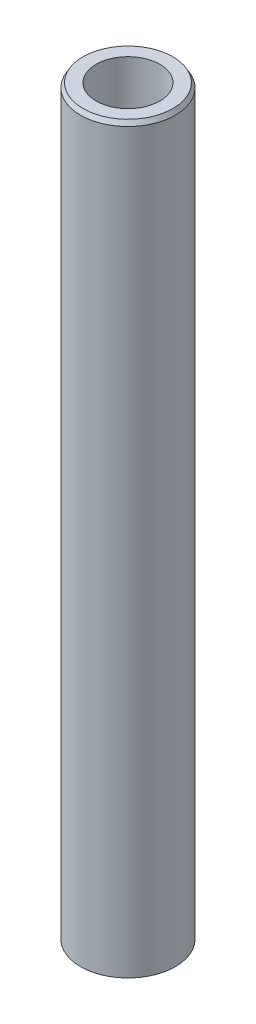
from build123d import *
from OCP.BRepFilletAPI import BRepFilletAPI_MakeChamfer

# Parameters (mm, degrees)
SKETCH1_R           = 12.5
BOSS_EXTRUDE1_DEPTH = 196.030144605
SKETCH2_R           = 8.387301792
CUT_EXTRUDE1_DEPTH  = 197.825601977
CHAMFER1_SIZE       = 1.175320227
CHAMFER1_SIZE2      = 0.678571449


with BuildPart() as part:
    # Sketch1 → Boss-Extrude1 (new body)
    with BuildSketch(Plane(origin=(0, 0, 0), x_dir=(1, 0, 0), z_dir=(0, 1, 0))):
        Circle(SKETCH1_R)
    extrude(amount=BOSS_EXTRUDE1_DEPTH)

    # Sketch2 → Cut-Extrude1 (cut, through all)
    with BuildSketch(Plane(origin=(0, 0, 0), x_dir=(1, 0, 0), z_dir=(0, 1, 0))):
        Circle(SKETCH2_R)
    extrude(amount=CUT_EXTRUDE1_DEPTH, mode=Mode.SUBTRACT)

    # Chamfer1: one chamfer whose edges measure the first distance from different faces: ONE call of the kernel's chamfer builder (chamfer() names one face for all edges)
    chamfer1_edges_1 = [part.edges().sort_by_distance(p)[0] for p in [
        (-12.5, 196.030144605, 0),
    ]]
    chamfer1_side_1 = [part.faces().sort_by_distance(p)[0] for p in [
        (-12.5, 98.015072302, 0),
    ]]
    chamfer1_edges_2 = [part.edges().sort_by_distance(p)[0] for p in [
        (-12.5, 0, 0),
    ]]
    chamfer1_side_2 = [part.faces().sort_by_distance(p)[0] for p in [
        (-12.146446609, 0, 0),
    ]]
    chamfer1 = BRepFilletAPI_MakeChamfer(part.part.solid().wrapped)
    for e in chamfer1_edges_1:
        chamfer1.Add(CHAMFER1_SIZE, CHAMFER1_SIZE2, e.wrapped, chamfer1_side_1[0].wrapped)  # the first distance lies on this face
    for e in chamfer1_edges_2:
        chamfer1.Add(CHAMFER1_SIZE, CHAMFER1_SIZE2, e.wrapped, chamfer1_side_2[0].wrapped)  # the first distance lies on this face
    add(Compound.cast(chamfer1.Shape()), mode=Mode.REPLACE)


solid = part.part
